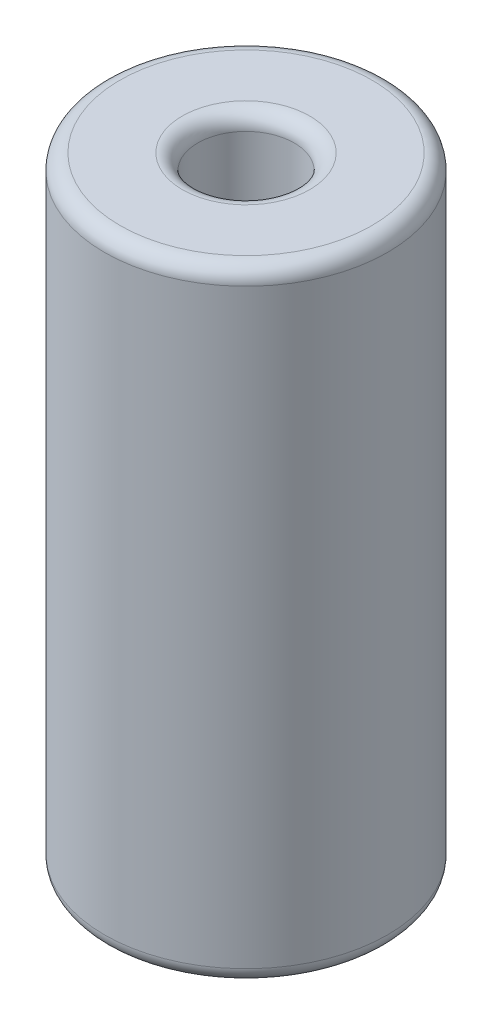
from build123d import *

# Parameters (mm, degrees)
SKETCH1_R           = 4.55
SKETCH1_R_2         = 1.55
BOSS_EXTRUDE1_DEPTH = 20
FILLET1_R           = 0.5


with BuildPart() as part:
    # Sketch1 → Boss-Extrude1 (new body)
    with BuildSketch(Plane(origin=(0, 0, 0), x_dir=(1, 0, 0), z_dir=(0, 1, 0))):
        Circle(SKETCH1_R)
        Circle(SKETCH1_R_2, mode=Mode.SUBTRACT)
    extrude(amount=BOSS_EXTRUDE1_DEPTH)

    # Fillet1
    fillet1_edges = [part.edges().sort_by_distance(p)[0] for p in [
        (-1.55, 0, 0),
        (-1.55, 20, 0),
        (-4.55, 0, 0),
        (-4.55, 20, 0),
    ]]
    fillet(fillet1_edges, radius=FILLET1_R)


solid = part.part
